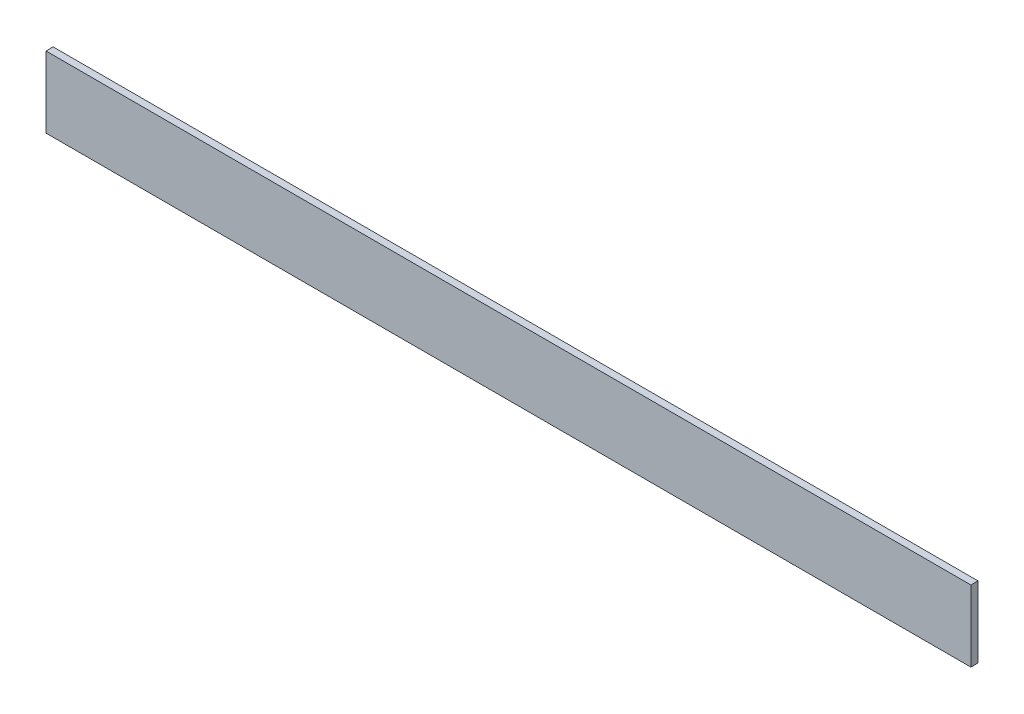
from build123d import *

# Parameters (mm, degrees)
IZIM1_W            = 1300
IZIM1_H            = 100
TABAN_FLAN_1_DEPTH = 10


# Sheet-metal steps are written as plain solids
with BuildPart() as part:
    # Çizim1 → Taban-Flanş1 (new body)
    with BuildSketch(Plane.XY):
        with Locations((650, -50)):
            Rectangle(IZIM1_W, IZIM1_H)
    extrude(amount=-TABAN_FLAN_1_DEPTH)


solid = part.part
